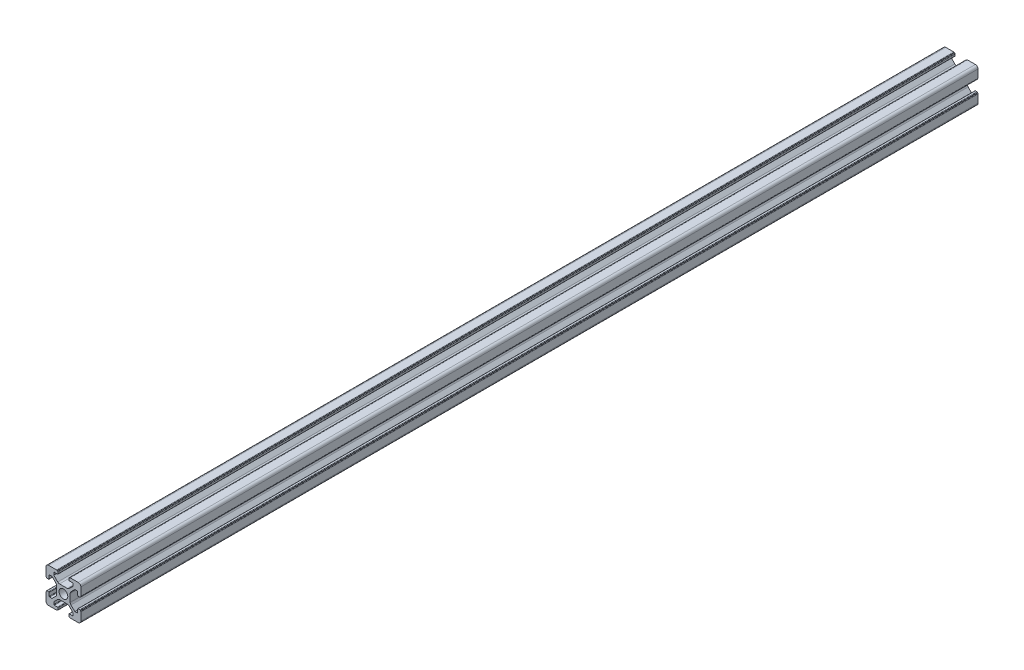
from build123d import *

# Parameters (mm, degrees)
BOSS_EXTRUDE1_DEPTH = 515
F_3DSKETCH2_R       = 2.5
CUT_EXTRUDE1_DEPTH  = 516.194204233


with BuildPart() as part:
    # Sketch1 → Boss-Extrude1 (new body)
    with BuildSketch(Plane.XY):
        with BuildLine():
            ThreePointArc((-4.339541497, 3.27832502), (-4.01438237, 2.791689997), (-3.900201668, 2.217664848))
            Line((-3.900201668, 2.217664848), (-3.900201668, -2.220777458))
            ThreePointArc((-3.900201668, -2.220777458), (-4.013982246, -2.793835668), (-4.338062619, -3.279956687))
            ThreePointArc((-4.338062619, -3.279956687), (-4.338801799, -3.280697416), (-4.339541497, -3.28143763))
            Line((-4.339541497, -3.28143763), (-6.559305445, -5.501201578))
            Line((-6.559305445, -5.501201578), (-7.918645273, -5.501201578))
            ThreePointArc((-7.918645273, -5.501201578), (-8.116635172, -5.419191476), (-8.198645273, -5.221201578))
            Line((-8.198645273, -5.221201578), (-8.198645273, -3.381201578))
            ThreePointArc((-8.198645273, -3.381201578), (-8.280655374, -3.183211679), (-8.478645273, -3.101201578))
            Line((-8.478645273, -3.101201578), (-9.418645273, -3.101201578))
            ThreePointArc((-9.418645273, -3.101201578), (-9.616635172, -3.183211679), (-9.698645273, -3.381201578))
            Line((-9.698645273, -3.381201578), (-9.698645273, -3.601201578))
            Line((-9.698645273, -3.601201578), (-9.718645273, -3.601201578))
            ThreePointArc((-9.718645273, -3.601201578), (-9.916635172, -3.683211679), (-9.998645273, -3.881201578))
            Line((-9.998645273, -3.881201578), (-9.998645273, -8.501201578))
            ThreePointArc((-9.998645273, -8.501201578), (-9.559305445, -9.561861749), (-8.498645273, -10.001201578))
            Line((-8.498645273, -10.001201578), (-3.878645273, -10.001201578))
            ThreePointArc((-3.878645273, -10.001201578), (-3.680655374, -9.919191476), (-3.598645273, -9.721201578))
            Line((-3.598645273, -9.721201578), (-3.598645273, -9.701201578))
            Line((-3.598645273, -9.701201578), (-3.378645273, -9.701201578))
            ThreePointArc((-3.378645273, -9.701201578), (-3.180655374, -9.619191476), (-3.098645273, -9.421201578))
            Line((-3.098645273, -9.421201578), (-3.098645273, -8.481201578))
            ThreePointArc((-3.098645273, -8.481201578), (-3.180655374, -8.283211679), (-3.378645273, -8.201201578))
            Line((-3.378645273, -8.201201578), (-5.218645273, -8.201201578))
            ThreePointArc((-5.218645273, -8.201201578), (-5.416635172, -8.119191476), (-5.498645273, -7.921201578))
            Line((-5.498645273, -7.921201578), (-5.498645273, -6.561861749))
            Line((-5.498645273, -6.561861749), (-3.277324929, -4.340541406))
            ThreePointArc((-3.277324929, -4.340541406), (-2.790689906, -4.015382279), (-2.216664757, -3.901201578))
            Line((-2.216664757, -3.901201578), (2.234977304, -3.899793498))
            ThreePointArc((2.234977304, -3.899793498), (2.801097117, -4.016727825), (3.280957809, -4.339061494))
            Line((3.280957809, -4.339061494), (5.502201668, -6.560305354))
            Line((5.502201668, -6.560305354), (5.502201668, -7.919645182))
            ThreePointArc((5.502201668, -7.919645182), (5.420191567, -8.117635081), (5.222201668, -8.199645182))
            Line((5.222201668, -8.199645182), (3.382201668, -8.199645182))
            ThreePointArc((3.382201668, -8.199645182), (3.18421177, -8.281655283), (3.102201668, -8.479645182))
            Line((3.102201668, -8.479645182), (3.102201668, -9.419645182))
            ThreePointArc((3.102201668, -9.419645182), (3.18421177, -9.617635081), (3.382201668, -9.699645182))
            Line((3.382201668, -9.699645182), (3.602201668, -9.699645182))
            Line((3.602201668, -9.699645182), (3.602201668, -9.719645182))
            ThreePointArc((3.602201668, -9.719645182), (3.68421177, -9.917635081), (3.882201668, -9.999645182))
            Line((3.882201668, -9.999645182), (8.502201668, -9.999645182))
            ThreePointArc((8.502201668, -9.999645182), (9.56286184, -9.560305354), (10.002201668, -8.499645182))
            Line((10.002201668, -8.499645182), (10.002201668, -3.879645182))
            ThreePointArc((10.002201668, -3.879645182), (9.920191567, -3.681655283), (9.722201668, -3.599645182))
            Line((9.722201668, -3.599645182), (9.702201668, -3.599645182))
            Line((9.702201668, -3.599645182), (9.702201668, -3.379645182))
            ThreePointArc((9.702201668, -3.379645182), (9.620191567, -3.181655283), (9.422201668, -3.099645182))
            Line((9.422201668, -3.099645182), (8.482201668, -3.099645182))
            ThreePointArc((8.482201668, -3.099645182), (8.28421177, -3.181655283), (8.202201668, -3.379645182))
            Line((8.202201668, -3.379645182), (8.202201668, -5.219645182))
            ThreePointArc((8.202201668, -5.219645182), (8.120191567, -5.417635081), (7.922201668, -5.499645182))
            Line((7.922201668, -5.499645182), (6.56286184, -5.499645182))
            Line((6.56286184, -5.499645182), (4.341541497, -3.278324838))
            ThreePointArc((4.341541497, -3.278324838), (4.01638237, -2.791689815), (3.902201668, -2.217664667))
            Line((3.902201668, -2.217664667), (3.900793589, 2.233977395))
            ThreePointArc((3.900793589, 2.233977395), (4.017727916, 2.800097207), (4.340061585, 3.2799579))
            Line((4.340061585, 3.2799579), (6.561305445, 5.501201759))
            Line((6.561305445, 5.501201759), (7.920645273, 5.501201759))
            ThreePointArc((7.920645273, 5.501201759), (8.118635172, 5.419191658), (8.200645273, 5.221201759))
            Line((8.200645273, 5.221201759), (8.200645273, 3.381201759))
            ThreePointArc((8.200645273, 3.381201759), (8.282655374, 3.183211861), (8.480645273, 3.101201759))
            Line((8.480645273, 3.101201759), (9.420645273, 3.101201759))
            ThreePointArc((9.420645273, 3.101201759), (9.618635172, 3.183211861), (9.700645273, 3.381201759))
            Line((9.700645273, 3.381201759), (9.700645273, 3.601201759))
            Line((9.700645273, 3.601201759), (9.720645273, 3.601201759))
            ThreePointArc((9.720645273, 3.601201759), (9.918635172, 3.683211861), (10.000645273, 3.881201759))
            Line((10.000645273, 3.881201759), (10.000645273, 8.501201759))
            ThreePointArc((10.000645273, 8.501201759), (9.561305445, 9.561861931), (8.500645273, 10.001201759))
            Line((8.500645273, 10.001201759), (3.880645273, 10.001201759))
            ThreePointArc((3.880645273, 10.001201759), (3.682655374, 9.919191658), (3.600645273, 9.721201759))
            Line((3.600645273, 9.721201759), (3.600645273, 9.701201759))
            Line((3.600645273, 9.701201759), (3.380645273, 9.701201759))
            ThreePointArc((3.380645273, 9.701201759), (3.182655374, 9.619191658), (3.100645273, 9.421201759))
            Line((3.100645273, 9.421201759), (3.100645273, 8.481201759))
            ThreePointArc((3.100645273, 8.481201759), (3.182655374, 8.283211861), (3.380645273, 8.201201759))
            Line((3.380645273, 8.201201759), (5.220645273, 8.201201759))
            ThreePointArc((5.220645273, 8.201201759), (5.418635172, 8.119191658), (5.500645273, 7.921201759))
            Line((5.500645273, 7.921201759), (5.500645273, 6.561861931))
            Line((5.500645273, 6.561861931), (3.279324929, 4.340541588))
            ThreePointArc((3.279324929, 4.340541588), (2.792689906, 4.015382461), (2.218664757, 3.901201759))
            Line((2.218664757, 3.901201759), (-2.232977304, 3.89979368))
            ThreePointArc((-2.232977304, 3.89979368), (-2.799097117, 4.016728006), (-3.278957809, 4.339061676))
            Line((-3.278957809, 4.339061676), (-5.500201668, 6.560305535))
            Line((-5.500201668, 6.560305535), (-5.500201668, 7.919645364))
            ThreePointArc((-5.500201668, 7.919645364), (-5.418191567, 8.117635262), (-5.220201668, 8.199645364))
            Line((-5.220201668, 8.199645364), (-3.380201668, 8.199645364))
            ThreePointArc((-3.380201668, 8.199645364), (-3.18221177, 8.281655465), (-3.100201668, 8.479645364))
            Line((-3.100201668, 8.479645364), (-3.100201668, 9.419645364))
            ThreePointArc((-3.100201668, 9.419645364), (-3.18221177, 9.617635262), (-3.380201668, 9.699645364))
            Line((-3.380201668, 9.699645364), (-3.600201668, 9.699645364))
            Line((-3.600201668, 9.699645364), (-3.600201668, 9.719645364))
            ThreePointArc((-3.600201668, 9.719645364), (-3.68221177, 9.917635262), (-3.880201668, 9.999645364))
            Line((-3.880201668, 9.999645364), (-8.500201668, 9.999645364))
            ThreePointArc((-8.500201668, 9.999645364), (-9.56086184, 9.560305535), (-10.000201668, 8.499645364))
            Line((-10.000201668, 8.499645364), (-10.000201668, 3.879645364))
            ThreePointArc((-10.000201668, 3.879645364), (-9.918191567, 3.681655465), (-9.720201668, 3.599645364))
            Line((-9.720201668, 3.599645364), (-9.700201668, 3.599645364))
            Line((-9.700201668, 3.599645364), (-9.700201668, 3.379645364))
            ThreePointArc((-9.700201668, 3.379645364), (-9.618191567, 3.181655465), (-9.420201668, 3.099645364))
            Line((-9.420201668, 3.099645364), (-8.480201668, 3.099645364))
            ThreePointArc((-8.480201668, 3.099645364), (-8.28221177, 3.181655465), (-8.200201668, 3.379645364))
            Line((-8.200201668, 3.379645364), (-8.200201668, 5.219645364))
            ThreePointArc((-8.200201668, 5.219645364), (-8.118191567, 5.417635262), (-7.920201668, 5.499645364))
            Line((-7.920201668, 5.499645364), (-6.56086184, 5.499645364))
            Line((-6.56086184, 5.499645364), (-4.339541497, 3.27832502))
        make_face()
    extrude(amount=BOSS_EXTRUDE1_DEPTH)

    # 3DSketch2 → Cut-Extrude1 (cut, through all)
    with BuildSketch(Plane.XY):
        Circle(F_3DSKETCH2_R)
    extrude(amount=CUT_EXTRUDE1_DEPTH, mode=Mode.SUBTRACT)


solid = part.part
